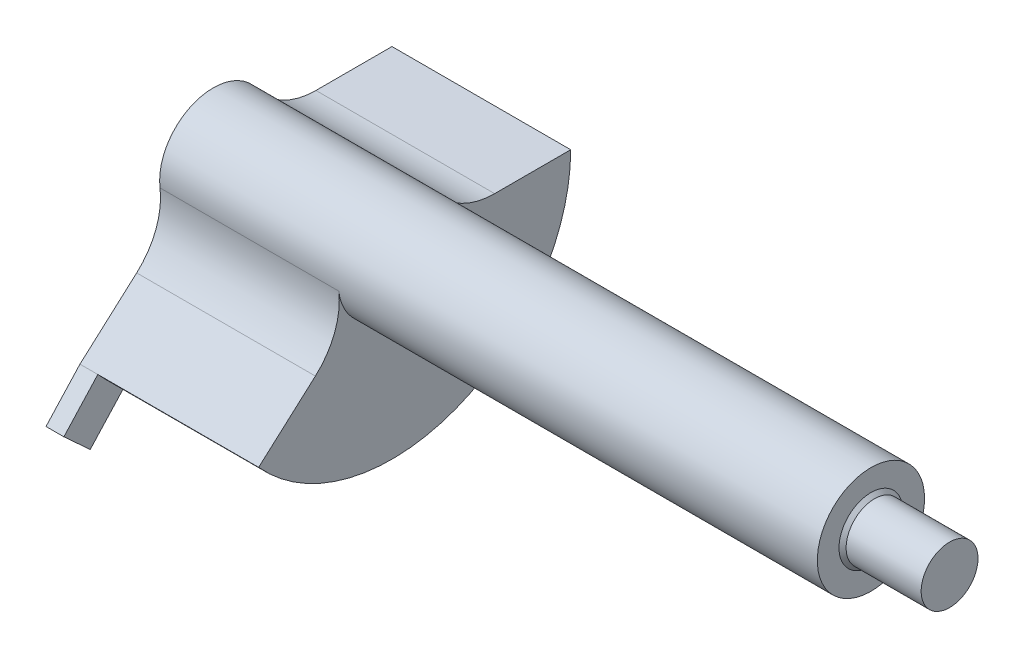
from build123d import *

# Parameters (mm, degrees)
SKETCH1_R                = 25
BOSS_EXTRUDE1_DEPTH      = 92
CUT_EXTRUDE1_START       = 12
CUT_EXTRUDE1_DEPTH       = 7
CUT_EXTRUDE2_START       = 48
CUT_EXTRUDE2_DEPTH       = 7
CUT_EXTRUDE3_START       = 24
CUT_EXTRUDE3_DEPTH       = 7
CUT_EXTRUDE7_START       = 60
CUT_EXTRUDE7_DEPTH       = 7
CUT_EXTRUDE8_START       = 36
CUT_EXTRUDE8_DEPTH       = 7
CUT_EXTRUDE9_START       = 72
CUT_EXTRUDE9_DEPTH       = 7
CUT_EXTRUDE10_DEPTH      = 8
CUT_EXTRUDE10_DEPTH_BACK = 64
CUT_EXTRUDE10_START      = 19
SKETCH1_28_R             = 2.575
CUT_EXTRUDE11_DEPTH      = 8
CUT_EXTRUDE11_DEPTH_BACK = 73
CUT_EXTRUDE11_START      = 31
SKETCH1_29_R             = 2.575
CUT_EXTRUDE12_DEPTH      = 8
CUT_EXTRUDE12_DEPTH_BACK = 183
CUT_EXTRUDE12_START      = 43
SKETCH1_30_R             = 2.575
CUT_EXTRUDE13_DEPTH      = 74
CUT_EXTRUDE13_DEPTH_BACK = 8
CUT_EXTRUDE13_START      = 48
SKETCH1_31_R             = 2.575
CUT_EXTRUDE14_DEPTH      = 87
CUT_EXTRUDE14_DEPTH_BACK = 8
CUT_EXTRUDE14_START      = 60
SKETCH1_32_R             = 2.575
CUT_EXTRUDE15_DEPTH      = 124
CUT_EXTRUDE15_DEPTH_BACK = 8
CUT_EXTRUDE15_START      = 72
SKETCH1_33_R             = 2.575
SKETCH2_R                = 2.6
CUT_EXTRUDE16_DEPTH      = 25
SKETCH4_R                = 3.975
BOSS_EXTRUDE2_DEPTH      = 11
SKETCH5_R                = 1.75
CUT_EXTRUDE17_DEPTH      = 58
CUT_EXTRUDE18_START      = -5
SKETCH5_3_R              = 1.75
CUT_EXTRUDE18_DEPTH      = 3
CUT_EXTRUDE19_START      = -14
SKETCH5_4_R              = 3.5
CUT_EXTRUDE19_DEPTH      = 95.89903586
CHAMFER1_SIZE            = 0.5
BOSS_EXTRUDE3_DEPTH      = 2.5
CUT_EXTRUDE20_START      = -67
SKETCH7_R                = 2.575
CUT_EXTRUDE20_DEPTH      = 67
CUT_EXTRUDE22_START      = -123
CUT_EXTRUDE22_DEPTH      = 123
FILLET1_R                = 10


with BuildPart() as part:
    # Sketch1 → Boss-Extrude1 (new body)
    with BuildSketch(Plane(origin=(0, 0, 0), x_dir=(0, 0, -1), z_dir=(1, 0, 0))):
        Circle(SKETCH1_R)
    extrude(amount=BOSS_EXTRUDE1_DEPTH)

    # Sketch1<3> → Cut-Extrude1 (cut)
    with BuildSketch(Plane(origin=(0, 0, 0), x_dir=(0, 0, -1), z_dir=(1, 0, 0)).offset(CUT_EXTRUDE1_START)):
        with BuildLine():
            ThreePointArc((8.618290005, -23.46753241), (17.67766953, -17.67766953), (23.46753241, -8.618290005))
            Line((23.46753241, -8.618290005), (21.867277208, -7.018034803))
            ThreePointArc((21.867277208, -7.018034803), (7.018034803, -7.018034803), (7.018034803, -21.867277208))
            Line((7.018034803, -21.867277208), (8.618290005, -23.46753241))
        make_face()
    extrude(amount=CUT_EXTRUDE1_DEPTH, mode=Mode.SUBTRACT)

    # Sketch1<8> → Cut-Extrude2 (cut)
    with BuildSketch(Plane(origin=(0, 0, 0), x_dir=(0, 0, -1), z_dir=(1, 0, 0)).offset(CUT_EXTRUDE2_START)):
        with BuildLine():
            ThreePointArc((20.425, 10.5), (9.925, 0), (20.425, -10.5))
            Line((20.425, -10.5), (22.688102609, -10.5))
            ThreePointArc((22.688102609, -10.5), (25, 0), (22.688102609, 10.5))
            Line((22.688102609, 10.5), (20.425, 10.5))
        make_face()
    extrude(amount=CUT_EXTRUDE2_DEPTH, mode=Mode.SUBTRACT)

    # Sketch1<9> → Cut-Extrude3 (cut)
    with BuildSketch(Plane(origin=(0, 0, 0), x_dir=(0, 0, -1), z_dir=(1, 0, 0)).offset(CUT_EXTRUDE3_START)):
        with BuildLine():
            ThreePointArc((7.018034803, 21.867277208), (7.018034803, 7.018034803), (21.867277208, 7.018034803))
            Line((21.867277208, 7.018034803), (23.46753241, 8.618290005))
            ThreePointArc((23.46753241, 8.618290005), (17.67766953, 17.67766953), (8.618290005, 23.46753241))
            Line((8.618290005, 23.46753241), (7.018034803, 21.867277208))
        make_face()
    extrude(amount=CUT_EXTRUDE3_DEPTH, mode=Mode.SUBTRACT)

    # Sketch1<10> → Cut-Extrude7 (cut)
    with BuildSketch(Plane(origin=(0, 0, 0), x_dir=(0, 0, -1), z_dir=(1, 0, 0)).offset(CUT_EXTRUDE7_START)):
        with BuildLine():
            Line((-10.5, 22.688102609), (-10.5, 20.425))
            ThreePointArc((-10.5, 20.425), (0, 9.925), (10.5, 20.425))
            Line((10.5, 20.425), (10.5, 22.688102609))
            ThreePointArc((10.5, 22.688102609), (0, 25), (-10.5, 22.688102609))
        make_face()
    extrude(amount=CUT_EXTRUDE7_DEPTH, mode=Mode.SUBTRACT)

    # Sketch1<11> → Cut-Extrude8 (cut)
    with BuildSketch(Plane(origin=(0, 0, 0), x_dir=(0, 0, -1), z_dir=(1, 0, 0)).offset(CUT_EXTRUDE8_START)):
        with BuildLine():
            Line((-23.46753241, 8.618290005), (-21.867277208, 7.018034803))
            ThreePointArc((-21.867277208, 7.018034803), (-7.018034803, 7.018034803), (-7.018034803, 21.867277208))
            Line((-7.018034803, 21.867277208), (-8.618290005, 23.46753241))
            ThreePointArc((-8.618290005, 23.46753241), (-17.67766953, 17.67766953), (-23.46753241, 8.618290005))
        make_face()
    extrude(amount=CUT_EXTRUDE8_DEPTH, mode=Mode.SUBTRACT)

    # Sketch1<12> → Cut-Extrude9 (cut)
    with BuildSketch(Plane(origin=(0, 0, 0), x_dir=(0, 0, -1), z_dir=(1, 0, 0)).offset(CUT_EXTRUDE9_START)):
        with BuildLine():
            Line((-22.688102609, -10.5), (-20.425, -10.5))
            ThreePointArc((-20.425, -10.5), (-9.925, 0), (-20.425, 10.5))
            Line((-20.425, 10.5), (-22.688102609, 10.5))
            ThreePointArc((-22.688102609, 10.5), (-25, 0), (-22.688102609, -10.5))
        make_face()
    extrude(amount=CUT_EXTRUDE9_DEPTH, mode=Mode.SUBTRACT)

    # Sketch1<28> → Cut-Extrude10 (cut, two sides: drawn at the far end of the back side and taken through both)
    with BuildSketch(Plane(origin=(0, 0, 0), x_dir=(0, 0, -1), z_dir=(1, 0, 0)).offset(CUT_EXTRUDE10_START - CUT_EXTRUDE10_DEPTH_BACK)):
        with Locations((14.442656006, -14.442656006)):
            Circle(SKETCH1_28_R)
    extrude(amount=CUT_EXTRUDE10_DEPTH + CUT_EXTRUDE10_DEPTH_BACK, mode=Mode.SUBTRACT)

    # Sketch1<29> → Cut-Extrude11 (cut, two sides: drawn at the far end of the back side and taken through both)
    with BuildSketch(Plane(origin=(0, 0, 0), x_dir=(0, 0, -1), z_dir=(1, 0, 0)).offset(CUT_EXTRUDE11_START - CUT_EXTRUDE11_DEPTH_BACK)):
        with Locations((14.442656006, 14.442656006)):
            Circle(SKETCH1_29_R)
    extrude(amount=CUT_EXTRUDE11_DEPTH + CUT_EXTRUDE11_DEPTH_BACK, mode=Mode.SUBTRACT)

    # Sketch1<30> → Cut-Extrude12 (cut, two sides: drawn at the far end of the back side and taken through both)
    with BuildSketch(Plane(origin=(0, 0, 0), x_dir=(0, 0, -1), z_dir=(1, 0, 0)).offset(CUT_EXTRUDE12_START - CUT_EXTRUDE12_DEPTH_BACK)):
        with Locations((-14.442656006, 14.442656006)):
            Circle(SKETCH1_30_R)
    extrude(amount=CUT_EXTRUDE12_DEPTH + CUT_EXTRUDE12_DEPTH_BACK, mode=Mode.SUBTRACT)

    # Sketch1<31> → Cut-Extrude13 (cut, two sides: drawn at the far end of the back side and taken through both)
    with BuildSketch(Plane(origin=(0, 0, 0), x_dir=(0, 0, -1), z_dir=(1, 0, 0)).offset(CUT_EXTRUDE13_START - CUT_EXTRUDE13_DEPTH_BACK)):
        with Locations((20.425, 0)):
            Circle(SKETCH1_31_R)
    extrude(amount=CUT_EXTRUDE13_DEPTH + CUT_EXTRUDE13_DEPTH_BACK, mode=Mode.SUBTRACT)

    # Sketch1<32> → Cut-Extrude14 (cut, two sides: drawn at the far end of the back side and taken through both)
    with BuildSketch(Plane(origin=(0, 0, 0), x_dir=(0, 0, -1), z_dir=(1, 0, 0)).offset(CUT_EXTRUDE14_START - CUT_EXTRUDE14_DEPTH_BACK)):
        with Locations((0, 20.425)):
            Circle(SKETCH1_32_R)
    extrude(amount=CUT_EXTRUDE14_DEPTH + CUT_EXTRUDE14_DEPTH_BACK, mode=Mode.SUBTRACT)

    # Sketch1<33> → Cut-Extrude15 (cut, two sides: drawn at the far end of the back side and taken through both)
    with BuildSketch(Plane(origin=(0, 0, 0), x_dir=(0, 0, -1), z_dir=(1, 0, 0)).offset(CUT_EXTRUDE15_START - CUT_EXTRUDE15_DEPTH_BACK)):
        with Locations((-20.425, 0)):
            Circle(SKETCH1_33_R)
    extrude(amount=CUT_EXTRUDE15_DEPTH + CUT_EXTRUDE15_DEPTH_BACK, mode=Mode.SUBTRACT)

    # Sketch2 → Cut-Extrude16 (cut)
    with BuildSketch(Plane.ZY):
        Circle(SKETCH2_R)
    extrude(amount=-CUT_EXTRUDE16_DEPTH, mode=Mode.SUBTRACT)

    # Sketch4 → Boss-Extrude2 (add)
    with BuildSketch(Plane(origin=(92, 0, 0), x_dir=(0, 0, -1), z_dir=(1, 0, 0))):
        Circle(SKETCH4_R)
    extrude(amount=BOSS_EXTRUDE2_DEPTH)

    # Sketch5 → Cut-Extrude17 (cut)
    with BuildSketch(Plane(origin=(0, 0, 0), x_dir=(1, 0, 0), z_dir=(0, 1, 0))):
        with Locations(Location((6.5, 0, 0), (0, 0, 270))):
            Circle(SKETCH5_R)
    extrude(amount=-CUT_EXTRUDE17_DEPTH, mode=Mode.SUBTRACT)

    # Sketch5<3> → Cut-Extrude18 (cut)
    # profile 1 of 5: a face of its own
    with BuildSketch(Plane(origin=(0, 0, 0), x_dir=(1, 0, 0), z_dir=(0, 1, 0)).offset(CUT_EXTRUDE18_START)):
        with BuildLine():
            Line((9.5, 1.802775638), (9.5, 3))
            Line((9.5, 3), (8.302775638, 3))
            ThreePointArc((8.302775638, 3), (8.974873734, 2.474873734), (9.5, 1.802775638))
        make_face()
    # profile 2 of 5: a face of its own
    with BuildSketch(Plane(origin=(0, 0, 0), x_dir=(1, 0, 0), z_dir=(0, 1, 0)).offset(CUT_EXTRUDE18_START)):
        with BuildLine():
            Line((8.302775638, 3), (4.697224362, 3))
            ThreePointArc((4.697224362, 3), (3, 0), (4.697224362, -3))
            Line((4.697224362, -3), (8.302775638, -3))
            ThreePointArc((8.302775638, -3), (8.974873734, -2.474873734), (9.5, -1.802775638))
            Line((9.5, -1.802775638), (9.5, 1.802775638))
            ThreePointArc((9.5, 1.802775638), (8.974873734, 2.474873734), (8.302775638, 3))
        make_face()
        with Locations(Location((6.5, 0, 0), (0, 0, 270))):
            Circle(SKETCH5_3_R, mode=Mode.SUBTRACT)
    # profile 3 of 5: a face of its own
    with BuildSketch(Plane(origin=(0, 0, 0), x_dir=(1, 0, 0), z_dir=(0, 1, 0)).offset(CUT_EXTRUDE18_START)):
        with BuildLine():
            Line((8.302775638, -3), (9.5, -3))
            Line((9.5, -3), (9.5, -1.802775638))
            ThreePointArc((9.5, -1.802775638), (8.974873734, -2.474873734), (8.302775638, -3))
        make_face()
    # profile 4 of 5: a face of its own
    with BuildSketch(Plane(origin=(0, 0, 0), x_dir=(1, 0, 0), z_dir=(0, 1, 0)).offset(CUT_EXTRUDE18_START)):
        with BuildLine():
            Line((4.697224362, 3), (0, 3))
            Line((0, 3), (0, -3))
            Line((0, -3), (4.697224362, -3))
            ThreePointArc((4.697224362, -3), (3, 0), (4.697224362, 3))
        make_face()
    # profile 5 of 5: a face of its own
    with BuildSketch(Plane(origin=(0, 0, 0), x_dir=(1, 0, 0), z_dir=(0, 1, 0)).offset(CUT_EXTRUDE18_START)):
        with Locations(Location((6.5, 0, 0), (0, 0, 270))):
            Circle(SKETCH5_3_R)
    extrude(amount=-CUT_EXTRUDE18_DEPTH, mode=Mode.SUBTRACT)

    # Sketch5<4> → Cut-Extrude19 (cut, through all)
    with BuildSketch(Plane(origin=(0, 0, 0), x_dir=(1, 0, 0), z_dir=(0, 1, 0)).offset(CUT_EXTRUDE19_START)):
        with Locations(Location((6.5, 0, 0), (0, 0, 270))):
            Circle(SKETCH5_4_R)
    extrude(amount=-CUT_EXTRUDE19_DEPTH, mode=Mode.SUBTRACT)

    # Chamfer1
    chamfer1_edges = [part.edges().sort_by_distance(p)[0] for p in [
        (92, 0, 3.975),
    ]]
    chamfer(chamfer1_edges, length=CHAMFER1_SIZE)

    # Sketch6 → Boss-Extrude3 (add)
    with BuildSketch(Plane.ZY):
        Polygon((23.3960034, -21.83178932), (19.709616716, -25.209740358), (12.95371464, -17.836966989), (16.640101324, -14.459015951), align=None)
    extrude(amount=-BOSS_EXTRUDE3_DEPTH)

    # Sketch7 → Cut-Extrude20 (cut)
    # profile 1 of 8: a face of its own
    with BuildSketch(Plane(origin=(92, 0, 0), x_dir=(0, 0, -1), z_dir=(1, 0, 0)).offset(CUT_EXTRUDE20_START)):
        with BuildLine():
            ThreePointArc((7.5, 0), (2.673139817, -7.007447718), (-5.594486272, -4.995170003))
            Line((-5.594486272, -4.995170003), (-18.648287572, -16.650566676))
            ThreePointArc((-18.648287572, -16.650566676), (8.910466057, -23.35815906), (25, 0))
            Line((25, 0), (23, 0))
            ThreePointArc((23, 0), (20.425, -2.575), (17.85, 0))
            Line((17.85, 0), (7.5, 0))
        make_face()
    # profile 2 of 8: a face of its own
    with BuildSketch(Plane(origin=(92, 0, 0), x_dir=(0, 0, -1), z_dir=(1, 0, 0)).offset(CUT_EXTRUDE20_START)):
        with BuildLine():
            Line((-18.648287572, -16.650566676), (-5.594486272, -4.995170003))
            ThreePointArc((-5.594486272, -4.995170003), (-2.673139817, 7.007447718), (7.5, 0))
            Line((7.5, 0), (17.85, 0))
            ThreePointArc((17.85, 0), (20.425, 2.575), (23, 0))
            Line((23, 0), (25, 0))
            ThreePointArc((25, 0), (-8.910466057, 23.35815906), (-18.648287572, -16.650566676))
        make_face()
        with Locations((-20.425, 0)):
            Circle(SKETCH7_R, mode=Mode.SUBTRACT)
        with Locations((0, 20.425)):
            Circle(SKETCH7_R, mode=Mode.SUBTRACT)
    # profile 3 of 8: a face of its own
    with BuildSketch(Plane(origin=(92, 0, 0), x_dir=(0, 0, -1), z_dir=(1, 0, 0)).offset(CUT_EXTRUDE20_START)):
        with Locations((-20.425, 0)):
            Circle(SKETCH7_R)
    # profile 4 of 8: a face of its own
    with BuildSketch(Plane(origin=(92, 0, 0), x_dir=(0, 0, -1), z_dir=(1, 0, 0)).offset(CUT_EXTRUDE20_START)):
        with Locations((0, 20.425)):
            Circle(SKETCH7_R)
    # profile 5 of 8: a face of its own
    with BuildSketch(Plane(origin=(92, 0, 0), x_dir=(0, 0, -1), z_dir=(1, 0, 0)).offset(CUT_EXTRUDE20_START)):
        with BuildLine():
            ThreePointArc((23, 0), (20.425, 2.575), (17.85, 0))
            Line((17.85, 0), (23, 0))
        make_face()
    # profile 6 of 8: a face of its own
    with BuildSketch(Plane(origin=(92, 0, 0), x_dir=(0, 0, -1), z_dir=(1, 0, 0)).offset(CUT_EXTRUDE20_START)):
        with BuildLine():
            Line((23, 0), (17.85, 0))
            ThreePointArc((17.85, 0), (20.425, -2.575), (23, 0))
        make_face()
    # profile 7 of 8: a face of its own
    with BuildSketch(Plane(origin=(92, 0, 0), x_dir=(0, 0, -1), z_dir=(1, 0, 0)).offset(CUT_EXTRUDE20_START)):
        with BuildLine():
            ThreePointArc((23, 0), (20.425, 2.575), (17.85, 0))
            Line((17.85, 0), (23, 0))
        make_face()
    # profile 8 of 8: a face of its own
    with BuildSketch(Plane(origin=(92, 0, 0), x_dir=(0, 0, -1), z_dir=(1, 0, 0)).offset(CUT_EXTRUDE20_START)):
        with BuildLine():
            Line((23, 0), (17.85, 0))
            ThreePointArc((17.85, 0), (20.425, -2.575), (23, 0))
        make_face()
    extrude(amount=CUT_EXTRUDE20_DEPTH, mode=Mode.SUBTRACT)

    # Sketch7<6> → Cut-Extrude22 (cut)
    with BuildSketch(Plane(origin=(92, 0, 0), x_dir=(0, 0, -1), z_dir=(1, 0, 0)).offset(CUT_EXTRUDE22_START)):
        with BuildLine():
            Line((-18.648287572, -16.650566676), (-5.594486272, -4.995170003))
            ThreePointArc((-5.594486272, -4.995170003), (-2.673139817, 7.007447718), (7.5, 0))
            Line((7.5, 0), (25, 0))
            ThreePointArc((25, 0), (-8.910466057, 23.35815906), (-18.648287572, -16.650566676))
        make_face()
    extrude(amount=CUT_EXTRUDE22_DEPTH, mode=Mode.SUBTRACT)

    # Fillet1
    # the kernel refuses this fillet: 10 mm, written as the material it adds along each edge
    with BuildSketch(Plane(origin=(0, 0, -7.5), x_dir=(0, 0.9541100058820106, 0.29945633517397796), z_dir=(1, 0, 0))) as fillet1_piece_1:
        with BuildLine():
            CenterArc((7.486408379, -9.541100059), FILLET1_R, 107.42495229, 55.150095421)
            Line((-2.054691679, -6.546536707), (0, 0))
            ThreePointArc((0, 0), (2.245922514, -0.344174956), (4.491845028, 0))
        make_face()
    extrude(amount=25)
    with BuildSketch(Plane(origin=(0, -4.995170003, 5.594486272), x_dir=(0, 0.9111454176217525, 0.4120849766090511), z_dir=(1, 0, 0))) as fillet1_piece_2:
        with BuildLine():
            CenterArc((7.486408379, 9.541100059), FILLET1_R, 197.42495229, 55.150095421)
            Line((-2.054691679, 6.546536707), (0, 0))
            ThreePointArc((0, 0), (2.245922514, 0.344174956), (4.491845028, 0))
        make_face()
    extrude(amount=25)


solid = part.part
